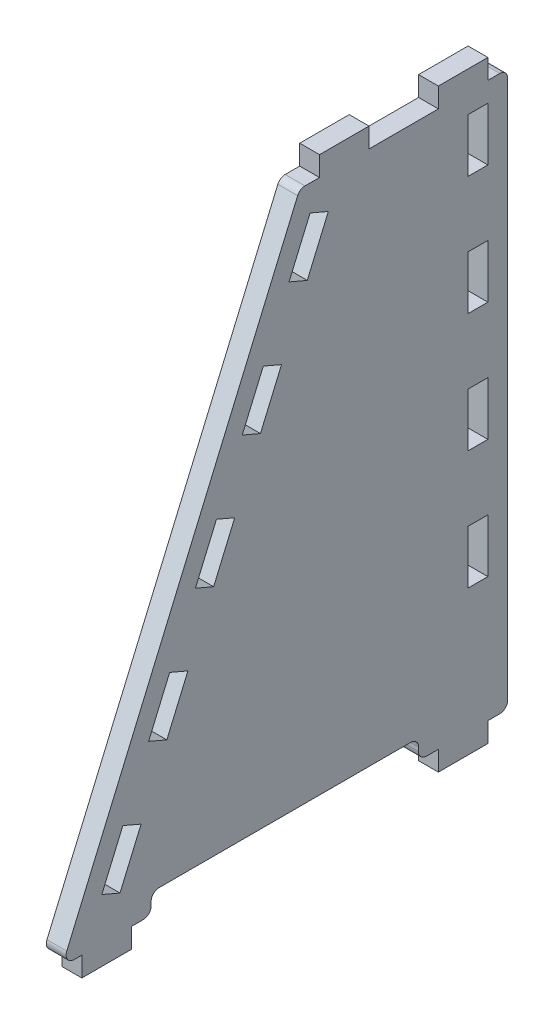
from build123d import *

# Parameters (mm, degrees)
BOSS_EXTRUDE1_DEPTH = 6.35
SKETCH2_W           = 6.35
SKETCH2_H           = 17.145
CUT_EXTRUDE1_DEPTH  = 146.297449758
FILLET1_R           = 2.54


with BuildPart() as part:
    # Sketch1 → Boss-Extrude1 (new body)
    with BuildSketch(Plane(origin=(0, 0, 0), x_dir=(0, 0, -1), z_dir=(1, 0, 0))):
        Polygon((-26.9875, 88.9), (-33.3375, 88.9), (-109.5375, -88.9), (-103.1875, -88.9), (-103.1875, -95.25), (-87.3125, -95.25), (-87.3125, -88.9), (-80.9625, -88.9), (-80.9625, -82.55), (4.7625, -82.55), (4.7625, -88.9), (11.1125, -88.9), (11.1125, -95.25), (26.9875, -95.25), (26.9875, -88.9), (33.3375, -88.9), (33.3375, 88.9), (26.9875, 88.9), (26.9875, 95.25), (11.1125, 95.25), (11.1125, 88.9), (-11.1125, 88.9), (-11.1125, 95.25), (-26.9875, 95.25), align=None)
    extrude(amount=BOSS_EXTRUDE1_DEPTH)

    # Sketch2 → Cut-Extrude1 (cut, through all)
    with BuildSketch(Plane(origin=(6.35, 0, 0), x_dir=(0, 0, -1), z_dir=(1, 0, 0))):
        with Locations((23.8125, 73.9775)):
            Rectangle(SKETCH2_W, SKETCH2_H)
        with Locations((23.8125, 35.8775)):
            Rectangle(SKETCH2_W, SKETCH2_H)
        with Locations((23.8125, -2.2225)):
            Rectangle(SKETCH2_W, SKETCH2_H)
        with Locations((23.8125, -40.3225)):
            Rectangle(SKETCH2_W, SKETCH2_H)
        Polygon((-30.002316605, 80.562041513), (-36.75606298, 64.803299974), (-30.919492039, 62.301912428), (-24.165745665, 78.060653967), align=None)
        Polygon((-45.010641881, 45.54261587), (-51.764388255, 29.78387433), (-45.927817315, 27.282486784), (-39.174070941, 43.041228324), align=None)
        Polygon((-60.018967157, 10.523190226), (-66.772713531, -5.235551314), (-60.936142591, -7.73693886), (-54.182396216, 8.02180268), align=None)
        Polygon((-75.027292433, -24.496235418), (-81.781038807, -40.254976957), (-75.944467866, -42.756364503), (-69.190721492, -26.997622964), align=None)
        Polygon((-90.035617709, -59.515661061), (-96.789364083, -75.274402601), (-90.952793142, -77.775790147), (-84.199046768, -62.017048607), align=None)
    extrude(amount=-CUT_EXTRUDE1_DEPTH, mode=Mode.SUBTRACT)

    # Fillet1
    fillet1_edges = [part.edges().sort_by_distance(p)[0] for p in [
        (3.175, 88.9, 33.3375),
        (3.175, 88.9, -33.3375),
        (3.175, -88.9, -33.3375),
        (3.175, -88.9, 109.5375),
        (3.175, -88.9, -4.7625),
        (3.175, -82.55, -4.7625),
        (3.175, -82.55, 80.9625),
        (3.175, -88.9, 80.9625),
    ]]
    fillet(fillet1_edges, radius=FILLET1_R)


solid = part.part
